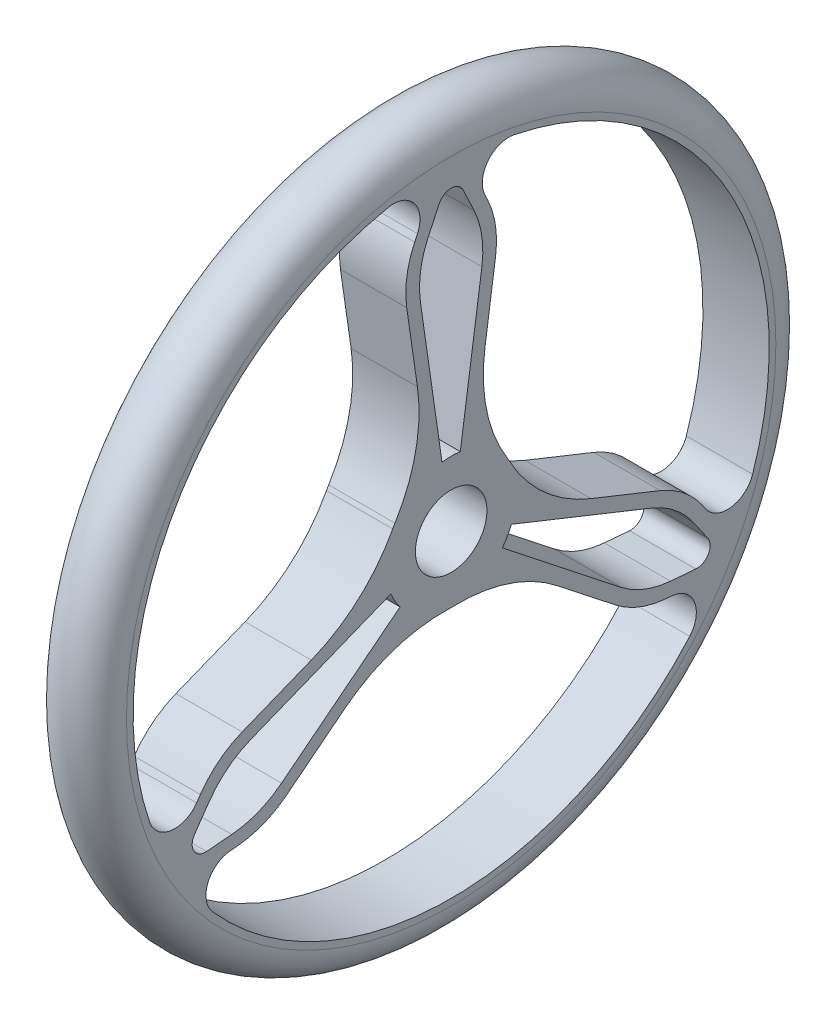
from build123d import *

# Parameters (mm, degrees)
SKETCH1_R           = 270
SKETCH1_R_2         = 240
BOSS_EXTRUDE1_DEPTH = 50
FILLET1_R           = 25
BOSS_EXTRUDE2_DEPTH = 50
SKETCH3_R           = 50
BOSS_EXTRUDE3_DEPTH = 50
SKETCH4_R           = 27
CUT_EXTRUDE1_DEPTH  = 50
SKETCH5_R           = 27
CUT_EXTRUDE2_DEPTH  = 50
FILLET2_R           = 120
FILLET3_R           = 120
FILLET4_R           = 120
FILLET5_R           = 120
FILLET6_R           = 120
FILLET7_R           = 120
FILLET8_R           = 70
FILLET9_R           = 70
FILLET10_R          = 70
FILLET11_R          = 70
FILLET12_R          = 70
FILLET13_R          = 70
FILLET14_R          = 70
FILLET15_R          = 70
FILLET16_R          = 70
FILLET17_R          = 70
FILLET18_R          = 70
FILLET19_R          = 70
FILLET20_R          = 20
FILLET21_R          = 20
FILLET22_R          = 20
FILLET23_R          = 20
FILLET24_R          = 20
FILLET25_R          = 20
FILLET26_R          = 10
FILLET27_R          = 10
FILLET28_R          = 10


with BuildPart() as part:
    # Sketch1 → Boss-Extrude1 (new body)
    with BuildSketch(Plane(origin=(0, 0, 0), x_dir=(0, 0, -1), z_dir=(1, 0, 0))):
        Circle(SKETCH1_R)
        Circle(SKETCH1_R_2, mode=Mode.SUBTRACT)
    extrude(amount=BOSS_EXTRUDE1_DEPTH)

    # Fillet1
    fillet1_edges = [part.edges().sort_by_distance(p)[0] for p in [
        (0, 0, 270),
        (50, 0, 270),
    ]]
    fillet(fillet1_edges, radius=FILLET1_R - 0.0001)  # a hair under: the kernel refuses the full size

    # Sketch2 → Boss-Extrude2 (add)
    with BuildSketch(Plane(origin=(0, 0, 0), x_dir=(0, 0, -1), z_dir=(1, 0, 0))):
        with BuildLine():
            Line((10.910154565, 6.298980675), (36.524952377, 183.573393863))
            Line((36.524952377, 183.573393863), (10, 239.791576166))
            ThreePointArc((10, 239.791576166), (0, 240), (-10, 239.791576166))
            Line((-10, 239.791576166), (-36.524952377, 183.573393863))
            Line((-36.524952377, 183.573393863), (-10.910154565, 6.298980675))
            Line((-10.910154565, 6.298980675), (-177.241698733, -60.155160301))
            Line((-177.241698733, -60.155160301), (-212.665596573, -111.235534045))
            ThreePointArc((-212.665596573, -111.235534045), (-207.846096908, -120), (-202.665596573, -128.556042121))
            Line((-202.665596573, -128.556042121), (-140.716746356, -123.418233562))
            Line((-140.716746356, -123.418233562), (0, -12.59796135))
            Line((0, -12.59796135), (140.716746356, -123.418233562))
            Line((140.716746356, -123.418233562), (202.665596573, -128.556042121))
            ThreePointArc((202.665596573, -128.556042121), (207.846096908, -120), (212.665596573, -111.235534045))
            Line((212.665596573, -111.235534045), (177.241698733, -60.155160301))
            Line((177.241698733, -60.155160301), (10.910154565, 6.298980675))
        make_face()
    extrude(amount=BOSS_EXTRUDE2_DEPTH)

    # Sketch3 → Boss-Extrude3 (add)
    with BuildSketch(Plane(origin=(50, 0, 0), x_dir=(0, 0, -1), z_dir=(1, 0, 0))):
        Circle(SKETCH3_R)
    extrude(amount=-BOSS_EXTRUDE3_DEPTH)

    # Sketch4 → Cut-Extrude1 (cut)
    with BuildSketch(Plane(origin=(50, 0, 0), x_dir=(0, 0, -1), z_dir=(1, 0, 0))):
        Circle(SKETCH4_R)
    extrude(amount=-CUT_EXTRUDE1_DEPTH, mode=Mode.SUBTRACT)

    # Sketch5 → Cut-Extrude2 (cut)
    with BuildSketch(Plane(origin=(50, 0, 0), x_dir=(0, 0, -1), z_dir=(1, 0, 0))):
        Circle(SKETCH5_R)
        with BuildLine():
            Line((-6.907151282, 48.521613039), (-26.197593694, 182.026545767))
            Line((-26.197593694, 182.026545767), (-0.956115014, 235.524475937))
            Line((-0.956115014, 235.524475937), (0, 237.550909289))
            Line((0, 237.550909289), (0.956115014, 235.524475937))
            Line((0.956115014, 235.524475937), (26.197593694, 182.026545767))
            Line((26.197593694, 182.026545767), (6.907151282, 48.521613039))
            ThreePointArc((6.907151282, 48.521613039), (0, 49.010770967), (-6.907151282, 48.521613039))
        make_face()
        with BuildLine():
            Line((45.474525166, -18.279038041), (170.738409645, -68.325491226))
            Line((170.738409645, -68.325491226), (204.448236882, -116.934218077))
            Line((204.448236882, -116.934218077), (205.725122137, -118.775454645))
            Line((205.725122137, -118.775454645), (203.492121867, -118.59025786))
            Line((203.492121867, -118.59025786), (144.54081595, -113.701054541))
            Line((144.54081595, -113.701054541), (38.567373883, -30.242574998))
            ThreePointArc((38.567373883, -30.242574998), (42.444572716, -24.505385483), (45.474525166, -18.279038041))
        make_face()
        with BuildLine():
            Line((-38.567373883, -30.242574998), (-144.54081595, -113.701054541))
            Line((-144.54081595, -113.701054541), (-203.492121867, -118.59025786))
            Line((-203.492121867, -118.59025786), (-205.725122137, -118.775454645))
            Line((-205.725122137, -118.775454645), (-204.448236882, -116.934218077))
            Line((-204.448236882, -116.934218077), (-170.738409645, -68.325491226))
            Line((-170.738409645, -68.325491226), (-45.474525166, -18.279038041))
            ThreePointArc((-45.474525166, -18.279038041), (-42.444572716, -24.505385483), (-38.567373883, -30.242574998))
        make_face()
    extrude(amount=-CUT_EXTRUDE2_DEPTH, mode=Mode.SUBTRACT)

    # Fillet2
    fillet2_edges = [part.edges().sort_by_distance(p)[0] for p in [
        (25, -38.098779813, -32.380286854),
    ]]
    fillet(fillet2_edges, radius=FILLET2_R)

    # Fillet3
    fillet3_edges = [part.edges().sort_by_distance(p)[0] for p in [
        (25, -8.992761091, -49.184654598),
    ]]
    fillet(fillet3_edges, radius=FILLET3_R)

    # Fillet4
    fillet4_edges = [part.edges().sort_by_distance(p)[0] for p in [
        (25, -38.098779813, 32.380286854),
    ]]
    fillet(fillet4_edges, radius=FILLET4_R)

    # Fillet5
    fillet5_edges = [part.edges().sort_by_distance(p)[0] for p in [
        (25, -8.992761091, 49.184654598),
    ]]
    fillet(fillet5_edges, radius=FILLET5_R)

    # Fillet6
    fillet6_edges = [part.edges().sort_by_distance(p)[0] for p in [
        (25, 47.091540904, 16.804367744),
    ]]
    fillet(fillet6_edges, radius=FILLET6_R)

    # Fillet7
    fillet7_edges = [part.edges().sort_by_distance(p)[0] for p in [
        (25, 47.091540904, -16.804367744),
    ]]
    fillet(fillet7_edges, radius=FILLET7_R)

    # Fillet8
    fillet8_edges = [part.edges().sort_by_distance(p)[0] for p in [
        (25, -123.418233562, -140.716746356),
    ]]
    fillet(fillet8_edges, radius=FILLET8_R)

    # Fillet9
    fillet9_edges = [part.edges().sort_by_distance(p)[0] for p in [
        (25, -60.155160301, -177.241698733),
    ]]
    fillet(fillet9_edges, radius=FILLET9_R)

    # Fillet10
    fillet10_edges = [part.edges().sort_by_distance(p)[0] for p in [
        (25, -123.418233562, 140.716746356),
    ]]
    fillet(fillet10_edges, radius=FILLET10_R)

    # Fillet11
    fillet11_edges = [part.edges().sort_by_distance(p)[0] for p in [
        (25, -60.155160301, 177.241698733),
    ]]
    fillet(fillet11_edges, radius=FILLET11_R)

    # Fillet12
    fillet12_edges = [part.edges().sort_by_distance(p)[0] for p in [
        (25, 183.573393863, 36.524952377),
    ]]
    fillet(fillet12_edges, radius=FILLET12_R)

    # Fillet13
    fillet13_edges = [part.edges().sort_by_distance(p)[0] for p in [
        (25, 183.573393863, -36.524952377),
    ]]
    fillet(fillet13_edges, radius=FILLET13_R)

    # Fillet14
    fillet14_edges = [part.edges().sort_by_distance(p)[0] for p in [
        (25, -113.701054541, -144.54081595),
    ]]
    fillet(fillet14_edges, radius=FILLET14_R)

    # Fillet15
    fillet15_edges = [part.edges().sort_by_distance(p)[0] for p in [
        (25, -68.325491226, -170.738409645),
    ]]
    fillet(fillet15_edges, radius=FILLET15_R)

    # Fillet16
    fillet16_edges = [part.edges().sort_by_distance(p)[0] for p in [
        (25, -68.325491226, 170.738409645),
    ]]
    fillet(fillet16_edges, radius=FILLET16_R)

    # Fillet17
    fillet17_edges = [part.edges().sort_by_distance(p)[0] for p in [
        (25, -113.701054541, 144.54081595),
    ]]
    fillet(fillet17_edges, radius=FILLET17_R)

    # Fillet18
    fillet18_edges = [part.edges().sort_by_distance(p)[0] for p in [
        (25, 182.026545767, -26.197593694),
    ]]
    fillet(fillet18_edges, radius=FILLET18_R)

    # Fillet19
    fillet19_edges = [part.edges().sort_by_distance(p)[0] for p in [
        (25, 182.026545767, 26.197593694),
    ]]
    fillet(fillet19_edges, radius=FILLET19_R)

    # Fillet20
    fillet20_edges = [part.edges().sort_by_distance(p)[0] for p in [
        (25, 239.791576166, -10),
    ]]
    fillet(fillet20_edges, radius=FILLET20_R)

    # Fillet21
    fillet21_edges = [part.edges().sort_by_distance(p)[0] for p in [
        (25, 239.791576166, 10),
    ]]
    fillet(fillet21_edges, radius=FILLET21_R)

    # Fillet22
    fillet22_edges = [part.edges().sort_by_distance(p)[0] for p in [
        (25, -111.235534045, -212.665596573),
    ]]
    fillet(fillet22_edges, radius=FILLET22_R)

    # Fillet23
    fillet23_edges = [part.edges().sort_by_distance(p)[0] for p in [
        (25, -128.556042121, -202.665596573),
    ]]
    fillet(fillet23_edges, radius=FILLET23_R)

    # Fillet24
    fillet24_edges = [part.edges().sort_by_distance(p)[0] for p in [
        (25, -128.556042121, 202.665596573),
    ]]
    fillet(fillet24_edges, radius=FILLET24_R)

    # Fillet25
    fillet25_edges = [part.edges().sort_by_distance(p)[0] for p in [
        (25, -111.235534045, 212.665596573),
    ]]
    fillet(fillet25_edges, radius=FILLET25_R)

    # Fillet26
    fillet26_edges = [part.edges().sort_by_distance(p)[0] for p in [
        (25, -118.775454645, -205.725122137),
    ]]
    fillet(fillet26_edges, radius=FILLET26_R)

    # Fillet27
    fillet27_edges = [part.edges().sort_by_distance(p)[0] for p in [
        (25, -118.775454645, 205.725122137),
    ]]
    fillet(fillet27_edges, radius=FILLET27_R)

    # Fillet28
    fillet28_edges = [part.edges().sort_by_distance(p)[0] for p in [
        (25, 237.550909289, 0),
    ]]
    fillet(fillet28_edges, radius=FILLET28_R)


solid = part.part
